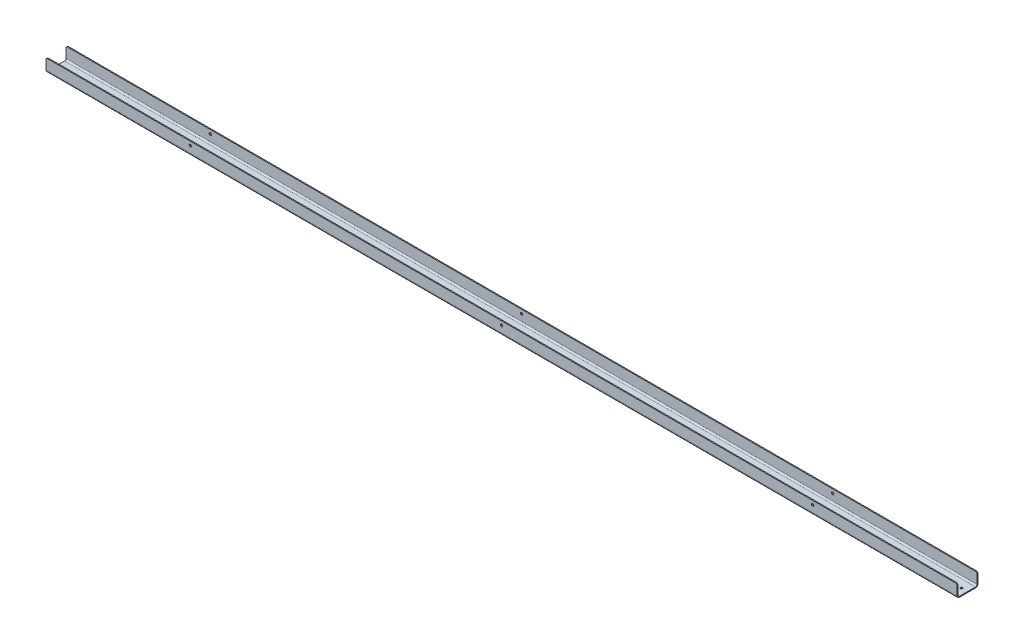
from build123d import *

# Parameters (mm, degrees)
BASE_FLANGE1_DEPTH = 1928.8125
SKETCH2_R          = 2.4511
CUT_EXTRUDE1_DEPTH = 1930.51962345
SKETCH3_R          = 2.4511
CUT_EXTRUDE2_DEPTH = 1930.51962345
FILLET1_R          = 3.175


# Sheet-metal steps are written as plain solids
with BuildPart() as part:
    # Sketch1 → Base-Flange1 (new body)
    with BuildSketch(Plane(origin=(0, 0, 0), x_dir=(0, 0, -1), z_dir=(1, 0, 0))):
        with BuildLine():
            Line((0, 27.432), (0, 5.207))
            ThreePointArc((0, 5.207), (1.52509499, 1.52509499), (5.207, 0))
            Line((5.207, 0), (39.243, 0))
            ThreePointArc((39.243, 0), (42.92490501, 1.52509499), (44.45, 5.207))
            Line((44.45, 5.207), (44.45, 27.432))
            Line((44.45, 27.432), (42.418, 27.432))
            Line((42.418, 27.432), (42.418, 5.207))
            ThreePointArc((42.418, 5.207), (41.48806403, 2.96193597), (39.243, 2.032))
            Line((39.243, 2.032), (5.207, 2.032))
            ThreePointArc((5.207, 2.032), (2.96193597, 2.96193597), (2.032, 5.207))
            Line((2.032, 5.207), (2.032, 27.432))
            Line((2.032, 27.432), (0, 27.432))
        make_face()
    extrude(amount=BASE_FLANGE1_DEPTH)

    # Sketch2 → Cut-Extrude1 (cut, through all)
    with BuildSketch(Plane(origin=(0, 0, 0), x_dir=(-1, 0, 0), z_dir=(0, -1, 0))):
        with Locations(Location((-12.7, 22.225, 0), (0, 0, 90))):
            Circle(SKETCH2_R)
        with Locations(Location((-31.75, 22.225, 0), (0, 0, 90))):
            Circle(SKETCH2_R)
        with Locations(Location((-650.90675, 22.225, 0), (0, 0, 90))):
            Circle(SKETCH2_R)
        with Locations(Location((-669.95675, 22.225, 0), (0, 0, 90))):
            Circle(SKETCH2_R)
        with Locations(Location((-1916.1125, 22.225, 0), (0, 0, 270))):
            Circle(SKETCH2_R)
        with Locations(Location((-1897.0625, 22.225, 0), (0, 0, 270))):
            Circle(SKETCH2_R)
        with Locations(Location((-1277.90575, 22.225, 0), (0, 0, 270))):
            Circle(SKETCH2_R)
        with Locations(Location((-1258.85575, 22.225, 0), (0, 0, 270))):
            Circle(SKETCH2_R)
    extrude(amount=-CUT_EXTRUDE1_DEPTH, mode=Mode.SUBTRACT)

    # Sketch3 → Cut-Extrude2 (cut, through all)
    with BuildSketch(Plane(origin=(0, 0, -44.45), x_dir=(-1, 0, 0), z_dir=(0, 0, -1))):
        with Locations((-1623.21875, 19.05)):
            Circle(SKETCH3_R)
        with Locations((-964.40625, 19.05)):
            Circle(SKETCH3_R)
        with Locations((-305.59375, 19.05)):
            Circle(SKETCH3_R)
    extrude(amount=-CUT_EXTRUDE2_DEPTH, mode=Mode.SUBTRACT)

    # Fillet1
    fillet1_edges = [part.edges().sort_by_distance(p)[0] for p in [
        (0, 27.432, -1.016),
        (0, 27.432, -43.434),
        (1928.8125, 27.432, -1.016),
        (1928.8125, 27.432, -43.434),
    ]]
    fillet(fillet1_edges, radius=FILLET1_R)


solid = part.part
